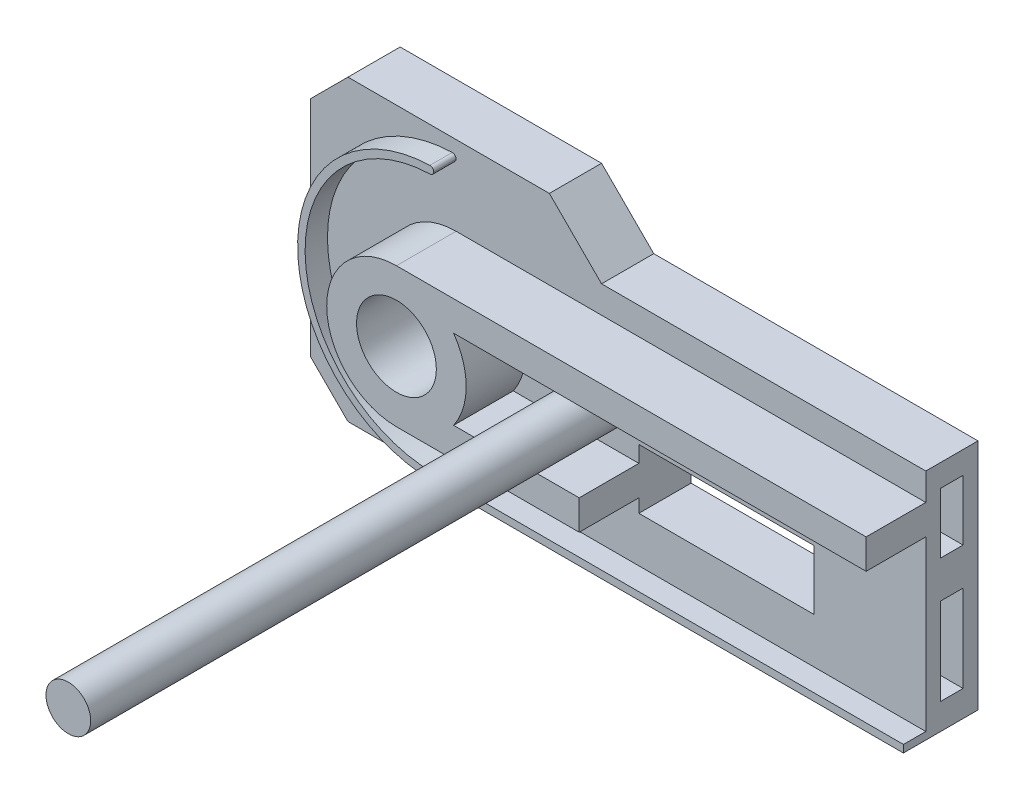
from build123d import *

# Parameters (mm, degrees)
SKETCH1_R               = 5.35
BOSS_EXTRUDE2_DEPTH     = 7
BOSS_EXTRUDE3_START     = 8
SKETCH3_R               = 5.35
BOSS_EXTRUDE3_DEPTH     = 8
BOSS_EXTRUDE4_DEPTH     = 3
CHAMFER1_SIZE           = 10
CHAMFER2_SIZE           = 5
CUT_EXTRUDE1_DEPTH      = 67.560662475
CUT_EXTRUDE1_DEPTH_BACK = 67.560662475
SKETCH5_W               = 23.474956737
SKETCH5_H               = 3.5
SKETCH5_H_2             = 8
CHAMFER3_SIZE           = 7
SKETCH6_W               = 3
SKETCH6_H               = 8.094956055
SKETCH6_H_2             = 11.655043945
CUT_EXTRUDE2_DEPTH      = 5
CUT_EXTRUDE3_REACH      = 87.249
SKETCH7_W               = 8
SKETCH7_H               = 4
SKETCH8_R               = 3
BOSS_EXTRUDE5_DEPTH     = 72
FILLET1_R               = 0.5


# Some blends are built 0.0001 mm under size
with BuildPart() as part:
    # Sketch1 → Boss-Extrude2 (new body)
    with BuildSketch(Plane.XY):
        Polygon((-19.503784034, -20), (19.503784034, -20), (19.503784034, -18.25), (62.978740771, -18.25), (62.978740771, 13), (19.503784034, 13), (19.503784034, 20), (-19.503784034, 20), align=None)
        Circle(SKETCH1_R, mode=Mode.SUBTRACT)
    extrude(amount=-BOSS_EXTRUDE2_DEPTH)

    # Sketch3 → Boss-Extrude3 (add)
    with BuildSketch(Plane.XY.offset(BOSS_EXTRUDE3_START)):
        with BuildLine():
            Line((7.668115805, 5.35), (62.978740771, 5.35))
            Line((62.978740771, 5.35), (62.978740771, 9.35))
            Line((62.978740771, 9.35), (0, 9.35))
            ThreePointArc((0, 9.35), (-9.35, 0), (0, -9.35))
            Line((0, -9.35), (62.978740771, -9.35))
            Line((62.978740771, -9.35), (62.978740771, -5.35))
            Line((62.978740771, -5.35), (7.668115805, -5.35))
            ThreePointArc((7.668115805, -5.35), (9.35, 0), (7.668115805, 5.35))
        make_face()
        Circle(SKETCH3_R, mode=Mode.SUBTRACT)
    extrude(amount=-BOSS_EXTRUDE3_DEPTH)

    # Sketch4 → Boss-Extrude4 (add)
    with BuildSketch(Plane.XY):
        with BuildLine():
            Line((0, -18.25), (62.978740771, -18.25))
            Line((62.978740771, -18.25), (62.978740771, -17.25))
            Line((62.978740771, -17.25), (8.306623863, -17.25))
            Line((8.306623863, -17.25), (0, -17.25))
            ThreePointArc((0, -17.25), (-17.25, 0), (0, 17.25))
            Line((0, 17.25), (0, 18.25))
            ThreePointArc((0, 18.25), (-18.25, 0), (0, -18.25))
        make_face()
    extrude(amount=BOSS_EXTRUDE4_DEPTH)

    # Chamfer1
    # the kernel refuses this chamfer: 10 mm, written as the material it takes off along each edge
    with BuildSketch(Plane(origin=(19.503784034, -20, 25.71682988), x_dir=(-0.9996219169112968, -0.027495876610586317, 0), z_dir=(0, 0, -1))) as chamfer1_piece_1_section:
        Polygon((CHAMFER1_SIZE * 0.999621916911, CHAMFER1_SIZE * 0.0274958766106), (-CHAMFER1_SIZE * 0.0274958766106, CHAMFER1_SIZE * 0.999621916911), (0, 0), align=None)
    chamfer1_piece_1 = extrude(amount=58.433659759, mode=Mode.PRIVATE)
    chamfer1_piece_1 = split(chamfer1_piece_1, bisect_by=Plane(origin=(14.814200223, -18.25, -3.5), z_dir=(0, -1, 0)), keep=Keep.TOP, mode=Mode.PRIVATE)
    add(chamfer1_piece_1, mode=Mode.SUBTRACT)

    # Chamfer2
    chamfer2_edges = [part.edges().sort_by_distance(p)[0] for p in [
        (-19.503784034, -20, -3.5),
        (-19.503784034, 20, -3.5),
    ]]
    chamfer(chamfer2_edges, length=CHAMFER2_SIZE)

    # Sketch5 → Cut-Extrude1 (cut, two sides: drawn at the far end of the back side and taken through both)
    with BuildSketch(Plane.XY.offset(-CUT_EXTRUDE1_DEPTH_BACK)):
        with Locations((36.241262403, 3.6)):
            Rectangle(SKETCH5_W, SKETCH5_H)
        with Locations((36.241262403, -7.15)):
            Rectangle(SKETCH5_W, SKETCH5_H_2)
    extrude(amount=CUT_EXTRUDE1_DEPTH + CUT_EXTRUDE1_DEPTH_BACK, mode=Mode.SUBTRACT)

    # Chamfer3
    chamfer3_edges = [part.edges().sort_by_distance(p)[0] for p in [
        (19.503784034, 20, -3.5),
    ]]
    chamfer(chamfer3_edges, length=CHAMFER3_SIZE - 0.0001)  # a hair under: the kernel refuses the full size

    # Sketch6 → Cut-Extrude2 (cut)
    with BuildSketch(Plane(origin=(62.978740771, 0, 0), x_dir=(0, 0, -1), z_dir=(1, 0, 0))):
        with Locations((3.5, 5.952521972)):
            Rectangle(SKETCH6_W, SKETCH6_H)
        with Locations((3.5, -8.922478028)):
            Rectangle(SKETCH6_W, SKETCH6_H_2)
    extrude(amount=-CUT_EXTRUDE2_DEPTH, mode=Mode.SUBTRACT)

    # Sketch7 → Cut-Extrude3 (cut, up to next)
    with BuildSketch(Plane(origin=(62.978740771, 0, 0), x_dir=(0, 0, -1), z_dir=(1, 0, 0)), mode=Mode.PRIVATE) as cut_extrude3_sk1:
        with Locations((-4, -7.35)):
            Rectangle(SKETCH7_W, SKETCH7_H)
    cut_extrude3_tool1 = extrude(cut_extrude3_sk1.sketch, amount=-CUT_EXTRUDE3_REACH, mode=Mode.PRIVATE) & part.part
    add(cut_extrude3_tool1.solids().sort_by_distance((62.978741, -7.35, 4))[0], mode=Mode.SUBTRACT)

    # Sketch8 → Boss-Extrude5 (add)
    with BuildSketch(Plane.XY):
        with Locations((20.003784034, 0)):
            Circle(SKETCH8_R)
    extrude(amount=BOSS_EXTRUDE5_DEPTH)

    # Fillet1
    fillet1_edges = [part.edges().sort_by_distance(p)[0] for p in [
        (0, 18.25, 1.5),
        (0, 17.25, 1.5),
    ]]
    fillet(fillet1_edges, radius=FILLET1_R - 0.0001)  # a hair under: the kernel refuses the full size


solid = part.part
